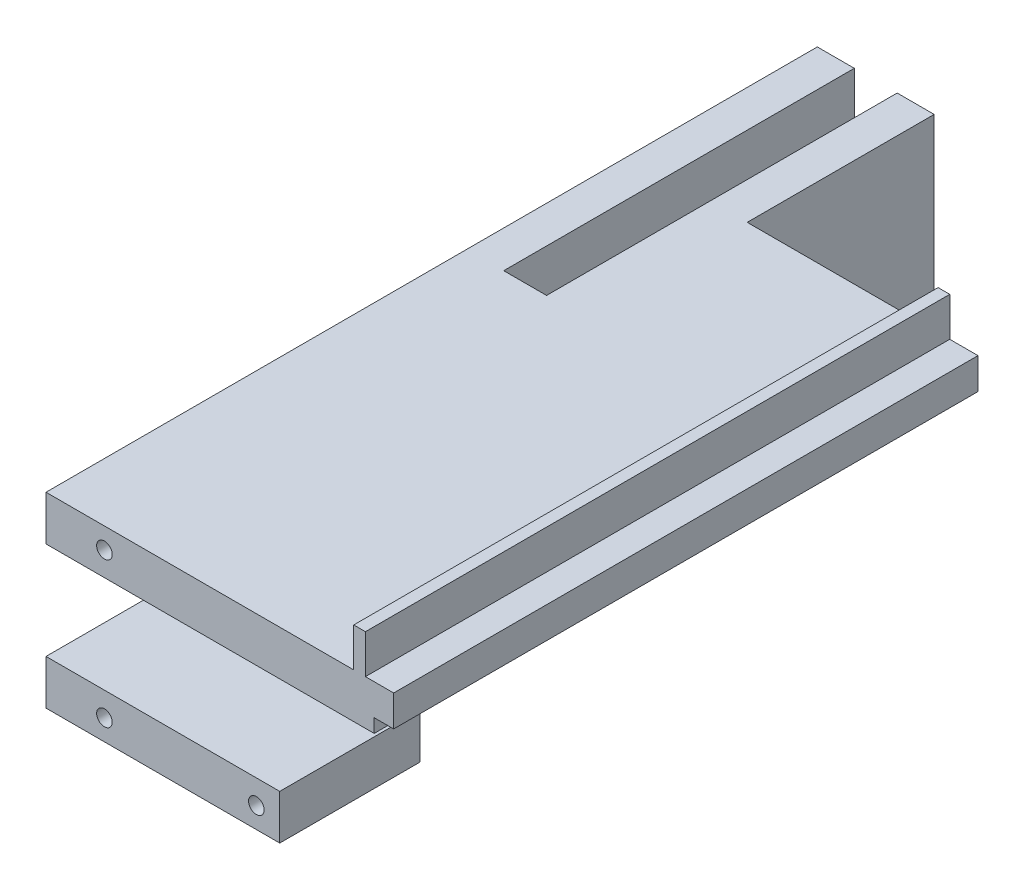
from build123d import *

# Parameters (mm, degrees)
CROQUIS1_W                 = 60
CROQUIS1_H                 = 48
SALIENTE_EXTRUIR1_DEPTH    = 6
CROQUIS4_W                 = 60
CROQUIS4_H                 = 11.5
SALIENTE_EXTRUIR3_DEPTH    = 30
CROQUIS5_R                 = 2
CORTAR_EXTRUIR3_DEPTH      = 16
CROQUIS6_W                 = 30
CROQUIS6_H                 = 48
SALIENTE_EXTRUIR4_DEPTH    = 162
CROQUIS7_R                 = 2
CORTAR_EXTRUIR4_DEPTH      = 16
CROQUIS11_W                = 150
CROQUIS11_H                = 11.5
SALIENTE_EXTRUIR6_DEPTH    = 59.25
CROQUIS12_W                = 3
CROQUIS12_H                = 150
SALIENTE_EXTRUIR7_DEPTH    = 10
CORTAR_EXTRUIR6_DEPTH      = 170.016303475
CORTAR_EXTRUIR6_DEPTH_BACK = 170.016303475
CROQUIS14_W                = 5
CROQUIS14_H                = 3.5
CORTAR_EXTRUIR7_DEPTH      = 213.768679181
CORTAR_EXTRUIR7_DEPTH_BACK = 90
CROQUIS15_W                = 11
CROQUIS15_H                = 11


with BuildPart() as part:
    # Croquis1 → Saliente-Extruir1 (new body)
    with BuildSketch(Plane.XY):
        with Locations((-36.216216216, 7.011261261)):
            Rectangle(CROQUIS1_W, CROQUIS1_H)
    extrude(amount=SALIENTE_EXTRUIR1_DEPTH)

    # Croquis4 → Saliente-Extruir3 (add)
    with BuildSketch(Plane.XY.offset(6)):
        with Locations((-36.216216216, 25.261261261)):
            Rectangle(CROQUIS4_W, CROQUIS4_H)
        with Locations((-36.216216216, -11.238738739)):
            Rectangle(CROQUIS4_W, CROQUIS4_H)
    extrude(amount=SALIENTE_EXTRUIR3_DEPTH)

    # Croquis5 → Cortar-Extruir3 (cut)
    with BuildSketch(Plane.XY.offset(36)):
        with Locations((-51.216216216, 25.661261261)):
            Circle(CROQUIS5_R)
        with Locations((-12.216216216, 25.661261261)):
            Circle(CROQUIS5_R)
        with Locations((-12.216216216, -11.638738739)):
            Circle(CROQUIS5_R)
        with Locations((-51.216216216, -11.638738739)):
            Circle(CROQUIS5_R)
    extrude(amount=-CORTAR_EXTRUIR3_DEPTH, mode=Mode.SUBTRACT)

    # Croquis6 → Saliente-Extruir4 (add)
    with BuildSketch(Plane(origin=(0, 0, 0), x_dir=(-1, 0, 0), z_dir=(0, 0, -1))):
        with Locations((51.216216216, 7.011261261)):
            Rectangle(CROQUIS6_W, CROQUIS6_H)
    extrude(amount=SALIENTE_EXTRUIR4_DEPTH)

    # Croquis7 → Cortar-Extruir4 (cut)
    with BuildSketch(Plane(origin=(0, 0, -162), x_dir=(-1, 0, 0), z_dir=(0, 0, -1))):
        with Locations((51.216216216, 7.011261261)):
            Circle(CROQUIS7_R)
    extrude(amount=-CORTAR_EXTRUIR4_DEPTH, mode=Mode.SUBTRACT)

    # Croquis11 → Saliente-Extruir6 (add)
    with BuildSketch(Plane(origin=(-36.216216216, 0, 0), x_dir=(0, 0, -1), z_dir=(1, 0, 0))):
        with Locations((39, 25.261261261)):
            Rectangle(CROQUIS11_W, CROQUIS11_H)
    extrude(amount=SALIENTE_EXTRUIR6_DEPTH)

    # Croquis12 → Saliente-Extruir7 (add)
    with BuildSketch(Plane(origin=(0, 31.011261261, 0), x_dir=(1, 0, 0), z_dir=(0, 1, 0))):
        with Locations((14.283783784, 39)):
            Rectangle(CROQUIS12_W, CROQUIS12_H)
    extrude(amount=SALIENTE_EXTRUIR7_DEPTH)

    # Croquis14 → Cortar-Extruir6 (cut, two sides: drawn at the far end of the back side and taken through both)
    with BuildSketch(Plane(origin=(0, 0, -114), x_dir=(-1, 0, 0), z_dir=(0, 0, -1)).offset(-CORTAR_EXTRUIR6_DEPTH_BACK)):
        with Locations((-20.533783784, 21.261261261)):
            Rectangle(CROQUIS14_W, CROQUIS14_H)
    extrude(amount=CORTAR_EXTRUIR6_DEPTH + CORTAR_EXTRUIR6_DEPTH_BACK, mode=Mode.SUBTRACT)

    # Croquis15 → Cortar-Extruir7 (cut, two sides: drawn at the far end of the back side and taken through both)
    with BuildSketch(Plane(origin=(0, 0, -162), x_dir=(-1, 0, 0), z_dir=(0, 0, -1)).offset(-CORTAR_EXTRUIR7_DEPTH_BACK)):
        with Locations((51.216216216, 25.511261261)):
            Rectangle(CROQUIS15_W, CROQUIS15_H)
    extrude(amount=CORTAR_EXTRUIR7_DEPTH + CORTAR_EXTRUIR7_DEPTH_BACK, mode=Mode.SUBTRACT)


solid = part.part
